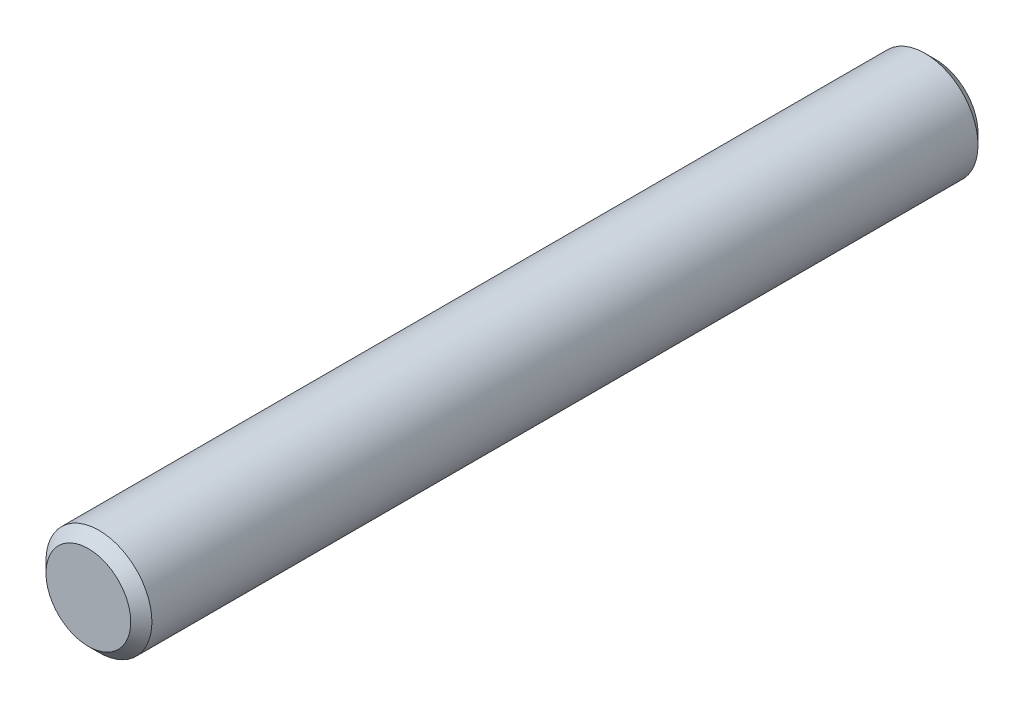
from build123d import *

# Parameters (mm, degrees)
SKIZZE1_R                       = 2.5
AUFSATZ_LINEAR_AUSTRAGEN1_DEPTH = 40
FASE1_SIZE                      = 0.5


with BuildPart() as part:
    # Skizze1 → Aufsatz-Linear austragen1 (new body)
    with BuildSketch(Plane.XY):
        Circle(SKIZZE1_R)
    extrude(amount=AUFSATZ_LINEAR_AUSTRAGEN1_DEPTH)

    # Fase1
    fase1_edges = [part.edges().sort_by_distance(p)[0] for p in [
        (-2.5, 0, 0),
        (-2.5, 0, 40),
    ]]
    chamfer(fase1_edges, length=FASE1_SIZE)


solid = part.part
